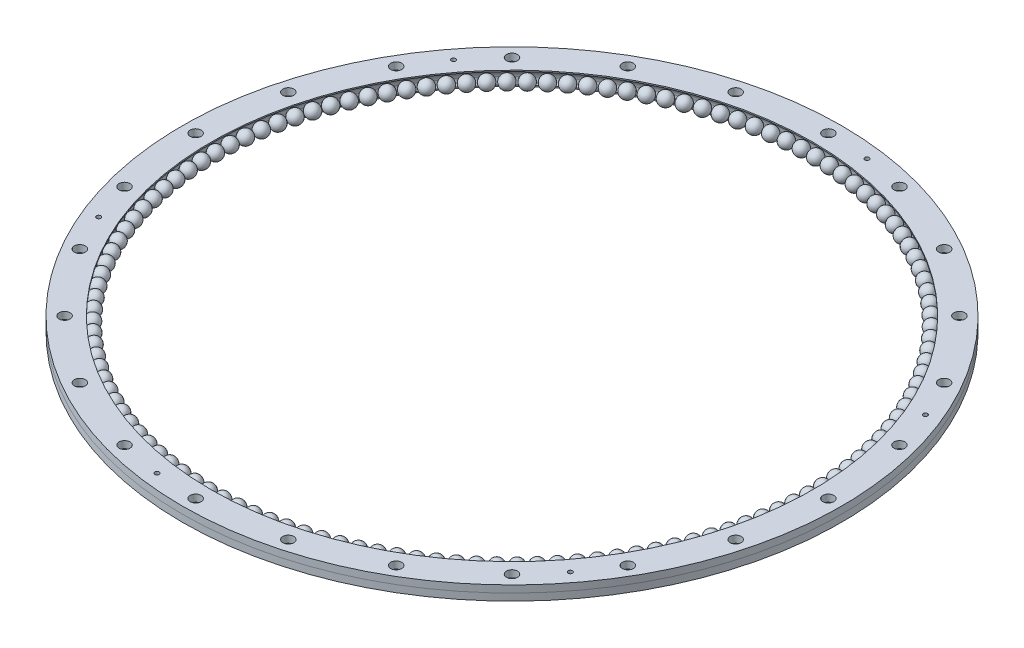
from build123d import *

# Parameters (mm, degrees)
BEARINGBALLPATTERN_COUNT           = 130
SKETCH3_R                          = 1.6
MOUNTINGTHRUHOLE_DEPTH             = 107.114278021
SKETCH5_W                          = 1.25
SKETCH5_H                          = 1.6
MOUNTINGSCREWPATTERN_START         = 6.935
MOUNTINGSCREWPATTERN_OUTLINE_R     = 1.25
MOUNTINGSCREWPATTERN_DEPTH         = 3.2
MOUNTINGSCREWPATTERN_2_OUTLINE_R   = 1.6
MOUNTINGSCREWPATTERN_2_OUTLINE_R_2 = 1.25
MOUNTINGSCREWPATTERN_2_DEPTH       = 1.6
SKETCH6_R                          = 0.5
DOWELPINHOLE_DEPTH                 = 107.114278021
CIRPATTERN4_COUNT                  = 6


# Read off the part's stored shape, not the designer's step: MountingScrewPattern
with BuildPart() as part:
    # Sketch1 → Revolve1 (revolve)
    with BuildSketch(Plane.XY, mode=Mode.PRIVATE) as revolve1_sk:
        with BuildLine():
            Line((-68.5, 6.935), (-68.5, 7.212124344))
            ThreePointArc((-68.5, 7.212124344), (-69, 8.535), (-68.5, 9.857875656))
            Line((-68.5, 9.857875656), (-68.5, 10.135))
            Line((-68.5, 10.135), (-75, 10.135))
            Line((-75, 10.135), (-75, 6.935))
            Line((-75, 6.935), (-68.5, 6.935))
        make_face()
    revolve(revolve1_sk.sketch.rotate(Axis((0, -200069.047495165, 0), (0, 1, 0)), 270), axis=Axis((0, -200069.047495165, 0), (0, 1, 0)))


with BuildPart() as body_2:
    # Split1: the piece on the far side of the plane
    add(part.part)
    split(bisect_by=Plane.ZX.offset(8.535), keep=Keep.BOTTOM)

    # Sketch3 → MountingThruHole (cut, through all)
    with BuildSketch(Plane.XZ.offset(-6.935)):
        with Locations(Location((0, -72, 0), (0, 0, 270))):
            Circle(SKETCH3_R)
    extrude(amount=-MOUNTINGTHRUHOLE_DEPTH, mode=Mode.SUBTRACT)


with BuildPart() as part_1:
    add(part.part)

    # Split1
    split(bisect_by=Plane.ZX.offset(8.535), keep=Keep.TOP)

    # Sketch5 → M3x0.5 Tapped Hole1 (revolve, cut)
    with BuildSketch(Plane(origin=(0, 8.535, -72), x_dir=(0, 0, -1), z_dir=(1, 0, 0))):
        with Locations((0.625, 0.8)):
            Rectangle(SKETCH5_W, SKETCH5_H)
    revolve(axis=Axis((0, 2.185, -72), (0, 1, 0)), mode=Mode.SUBTRACT)


with BuildPart() as body_3:
    # Sketch2 → BearingBall (revolve)
    with BuildSketch(Plane.XY):
        with BuildLine():
            Line((-67.5, 7.035), (-67.5, 10.035))
            ThreePointArc((-67.5, 10.035), (-69, 8.535), (-67.5, 7.035))
        make_face()
    revolve(axis=Axis((-67.5, 10.035, 0), (0, 1, 0)))

    # BearingBallPattern: body 3 ×130 about axis
    bearingballpattern_axis = Axis((0, 0, 0), (0, 1, 0))


with BuildPart() as body_3_1:
    add(body_3.part)
    for i in range(1, BEARINGBALLPATTERN_COUNT):
        add(body_3.part.rotate(bearingballpattern_axis, i * 360 / BEARINGBALLPATTERN_COUNT))


with BuildPart() as mountingscrewpattern_tool:
    # MountingScrewPattern outline → MountingScrewPattern (new body)
    with BuildSketch(Plane(origin=(0, 0, 0), x_dir=(1, 0, 0), z_dir=(0, 1, 0)).offset(MOUNTINGSCREWPATTERN_START)):
        with Locations((18.634971247, 69.546659493)):
            Circle(MOUNTINGSCREWPATTERN_OUTLINE_R)
        with Locations((-18.634971247, 69.546659493)):
            Circle(MOUNTINGSCREWPATTERN_OUTLINE_R)
        with Locations((-36, 62.353829072)):
            Circle(MOUNTINGSCREWPATTERN_OUTLINE_R)
        with Locations((-50.911688245, 50.911688245)):
            Circle(MOUNTINGSCREWPATTERN_OUTLINE_R)
        with Locations((-62.353829072, 36)):
            Circle(MOUNTINGSCREWPATTERN_OUTLINE_R)
        with Locations((-69.546659493, 18.634971247)):
            Circle(MOUNTINGSCREWPATTERN_OUTLINE_R)
        with Locations((-72, 0)):
            Circle(MOUNTINGSCREWPATTERN_OUTLINE_R)
        with Locations((36, 62.353829072)):
            Circle(MOUNTINGSCREWPATTERN_OUTLINE_R)
        with Locations((50.911688245, 50.911688245)):
            Circle(MOUNTINGSCREWPATTERN_OUTLINE_R)
        with Locations((62.353829072, 36)):
            Circle(MOUNTINGSCREWPATTERN_OUTLINE_R)
        with Locations((69.546659493, 18.634971247)):
            Circle(MOUNTINGSCREWPATTERN_OUTLINE_R)
        with Locations((72, 0)):
            Circle(MOUNTINGSCREWPATTERN_OUTLINE_R)
        with Locations((69.546659493, -18.634971247)):
            Circle(MOUNTINGSCREWPATTERN_OUTLINE_R)
        with Locations((62.353829072, -36)):
            Circle(MOUNTINGSCREWPATTERN_OUTLINE_R)
        with Locations((50.911688245, -50.911688245)):
            Circle(MOUNTINGSCREWPATTERN_OUTLINE_R)
        with Locations((36, -62.353829072)):
            Circle(MOUNTINGSCREWPATTERN_OUTLINE_R)
        with Locations((18.634971247, -69.546659493)):
            Circle(MOUNTINGSCREWPATTERN_OUTLINE_R)
        with Locations((0, -72)):
            Circle(MOUNTINGSCREWPATTERN_OUTLINE_R)
        with Locations((-18.634971247, -69.546659493)):
            Circle(MOUNTINGSCREWPATTERN_OUTLINE_R)
        with Locations((-36, -62.353829072)):
            Circle(MOUNTINGSCREWPATTERN_OUTLINE_R)
        with Locations((-50.911688245, -50.911688245)):
            Circle(MOUNTINGSCREWPATTERN_OUTLINE_R)
        with Locations((-62.353829072, -36)):
            Circle(MOUNTINGSCREWPATTERN_OUTLINE_R)
        with Locations((-69.546659493, -18.634971247)):
            Circle(MOUNTINGSCREWPATTERN_OUTLINE_R)
    extrude(amount=MOUNTINGSCREWPATTERN_DEPTH)


with BuildPart() as part_2:
    add(part_1.part)

    # MountingScrewPattern: cut by mountingscrewpattern_tool
    add(mountingscrewpattern_tool.part, mode=Mode.SUBTRACT)


with BuildPart() as body_2_1:
    add(body_2.part)

    # MountingScrewPattern: cut by mountingscrewpattern_tool
    add(mountingscrewpattern_tool.part, mode=Mode.SUBTRACT)

    # MountingScrewPattern 2 outline → MountingScrewPattern 2 (cut)
    # profile 1 of 23: a face of its own
    with BuildSketch(Plane(origin=(0, 0, 0), x_dir=(1, 0, 0), z_dir=(0, 1, 0)).offset(MOUNTINGSCREWPATTERN_START)):
        with Locations((18.634971247, 69.546659493)):
            Circle(MOUNTINGSCREWPATTERN_2_OUTLINE_R)
        with Locations((18.634971247, 69.546659493)):
            Circle(MOUNTINGSCREWPATTERN_2_OUTLINE_R_2, mode=Mode.SUBTRACT)
    # profile 2 of 23: a face of its own
    with BuildSketch(Plane(origin=(0, 0, 0), x_dir=(1, 0, 0), z_dir=(0, 1, 0)).offset(MOUNTINGSCREWPATTERN_START)):
        with Locations((-18.634971247, 69.546659493)):
            Circle(MOUNTINGSCREWPATTERN_2_OUTLINE_R)
        with Locations((-18.634971247, 69.546659493)):
            Circle(MOUNTINGSCREWPATTERN_2_OUTLINE_R_2, mode=Mode.SUBTRACT)
    # profile 3 of 23: a face of its own
    with BuildSketch(Plane(origin=(0, 0, 0), x_dir=(1, 0, 0), z_dir=(0, 1, 0)).offset(MOUNTINGSCREWPATTERN_START)):
        with Locations((-36, 62.353829072)):
            Circle(MOUNTINGSCREWPATTERN_2_OUTLINE_R)
        with Locations((-36, 62.353829072)):
            Circle(MOUNTINGSCREWPATTERN_2_OUTLINE_R_2, mode=Mode.SUBTRACT)
    # profile 4 of 23: a face of its own
    with BuildSketch(Plane(origin=(0, 0, 0), x_dir=(1, 0, 0), z_dir=(0, 1, 0)).offset(MOUNTINGSCREWPATTERN_START)):
        with Locations((-50.911688245, 50.911688245)):
            Circle(MOUNTINGSCREWPATTERN_2_OUTLINE_R)
        with Locations((-50.911688245, 50.911688245)):
            Circle(MOUNTINGSCREWPATTERN_2_OUTLINE_R_2, mode=Mode.SUBTRACT)
    # profile 5 of 23: a face of its own
    with BuildSketch(Plane(origin=(0, 0, 0), x_dir=(1, 0, 0), z_dir=(0, 1, 0)).offset(MOUNTINGSCREWPATTERN_START)):
        with Locations((-62.353829072, 36)):
            Circle(MOUNTINGSCREWPATTERN_2_OUTLINE_R)
        with Locations((-62.353829072, 36)):
            Circle(MOUNTINGSCREWPATTERN_2_OUTLINE_R_2, mode=Mode.SUBTRACT)
    # profile 6 of 23: a face of its own
    with BuildSketch(Plane(origin=(0, 0, 0), x_dir=(1, 0, 0), z_dir=(0, 1, 0)).offset(MOUNTINGSCREWPATTERN_START)):
        with Locations((-69.546659493, 18.634971247)):
            Circle(MOUNTINGSCREWPATTERN_2_OUTLINE_R)
        with Locations((-69.546659493, 18.634971247)):
            Circle(MOUNTINGSCREWPATTERN_2_OUTLINE_R_2, mode=Mode.SUBTRACT)
    # profile 7 of 23: a face of its own
    with BuildSketch(Plane(origin=(0, 0, 0), x_dir=(1, 0, 0), z_dir=(0, 1, 0)).offset(MOUNTINGSCREWPATTERN_START)):
        with Locations((-72, 0)):
            Circle(MOUNTINGSCREWPATTERN_2_OUTLINE_R)
        with Locations((-72, 0)):
            Circle(MOUNTINGSCREWPATTERN_2_OUTLINE_R_2, mode=Mode.SUBTRACT)
    # profile 8 of 23: a face of its own
    with BuildSketch(Plane(origin=(0, 0, 0), x_dir=(1, 0, 0), z_dir=(0, 1, 0)).offset(MOUNTINGSCREWPATTERN_START)):
        with Locations((36, 62.353829072)):
            Circle(MOUNTINGSCREWPATTERN_2_OUTLINE_R)
        with Locations((36, 62.353829072)):
            Circle(MOUNTINGSCREWPATTERN_2_OUTLINE_R_2, mode=Mode.SUBTRACT)
    # profile 9 of 23: a face of its own
    with BuildSketch(Plane(origin=(0, 0, 0), x_dir=(1, 0, 0), z_dir=(0, 1, 0)).offset(MOUNTINGSCREWPATTERN_START)):
        with Locations((50.911688245, 50.911688245)):
            Circle(MOUNTINGSCREWPATTERN_2_OUTLINE_R)
        with Locations((50.911688245, 50.911688245)):
            Circle(MOUNTINGSCREWPATTERN_2_OUTLINE_R_2, mode=Mode.SUBTRACT)
    # profile 10 of 23: a face of its own
    with BuildSketch(Plane(origin=(0, 0, 0), x_dir=(1, 0, 0), z_dir=(0, 1, 0)).offset(MOUNTINGSCREWPATTERN_START)):
        with Locations((62.353829072, 36)):
            Circle(MOUNTINGSCREWPATTERN_2_OUTLINE_R)
        with Locations((62.353829072, 36)):
            Circle(MOUNTINGSCREWPATTERN_2_OUTLINE_R_2, mode=Mode.SUBTRACT)
    # profile 11 of 23: a face of its own
    with BuildSketch(Plane(origin=(0, 0, 0), x_dir=(1, 0, 0), z_dir=(0, 1, 0)).offset(MOUNTINGSCREWPATTERN_START)):
        with Locations((69.546659493, 18.634971247)):
            Circle(MOUNTINGSCREWPATTERN_2_OUTLINE_R)
        with Locations((69.546659493, 18.634971247)):
            Circle(MOUNTINGSCREWPATTERN_2_OUTLINE_R_2, mode=Mode.SUBTRACT)
    # profile 12 of 23: a face of its own
    with BuildSketch(Plane(origin=(0, 0, 0), x_dir=(1, 0, 0), z_dir=(0, 1, 0)).offset(MOUNTINGSCREWPATTERN_START)):
        with Locations((72, 0)):
            Circle(MOUNTINGSCREWPATTERN_2_OUTLINE_R)
        with Locations((72, 0)):
            Circle(MOUNTINGSCREWPATTERN_2_OUTLINE_R_2, mode=Mode.SUBTRACT)
    # profile 13 of 23: a face of its own
    with BuildSketch(Plane(origin=(0, 0, 0), x_dir=(1, 0, 0), z_dir=(0, 1, 0)).offset(MOUNTINGSCREWPATTERN_START)):
        with Locations((69.546659493, -18.634971247)):
            Circle(MOUNTINGSCREWPATTERN_2_OUTLINE_R)
        with Locations((69.546659493, -18.634971247)):
            Circle(MOUNTINGSCREWPATTERN_2_OUTLINE_R_2, mode=Mode.SUBTRACT)
    # profile 14 of 23: a face of its own
    with BuildSketch(Plane(origin=(0, 0, 0), x_dir=(1, 0, 0), z_dir=(0, 1, 0)).offset(MOUNTINGSCREWPATTERN_START)):
        with Locations((62.353829072, -36)):
            Circle(MOUNTINGSCREWPATTERN_2_OUTLINE_R)
        with Locations((62.353829072, -36)):
            Circle(MOUNTINGSCREWPATTERN_2_OUTLINE_R_2, mode=Mode.SUBTRACT)
    # profile 15 of 23: a face of its own
    with BuildSketch(Plane(origin=(0, 0, 0), x_dir=(1, 0, 0), z_dir=(0, 1, 0)).offset(MOUNTINGSCREWPATTERN_START)):
        with Locations((50.911688245, -50.911688245)):
            Circle(MOUNTINGSCREWPATTERN_2_OUTLINE_R)
        with Locations((50.911688245, -50.911688245)):
            Circle(MOUNTINGSCREWPATTERN_2_OUTLINE_R_2, mode=Mode.SUBTRACT)
    # profile 16 of 23: a face of its own
    with BuildSketch(Plane(origin=(0, 0, 0), x_dir=(1, 0, 0), z_dir=(0, 1, 0)).offset(MOUNTINGSCREWPATTERN_START)):
        with Locations((36, -62.353829072)):
            Circle(MOUNTINGSCREWPATTERN_2_OUTLINE_R)
        with Locations((36, -62.353829072)):
            Circle(MOUNTINGSCREWPATTERN_2_OUTLINE_R_2, mode=Mode.SUBTRACT)
    # profile 17 of 23: a face of its own
    with BuildSketch(Plane(origin=(0, 0, 0), x_dir=(1, 0, 0), z_dir=(0, 1, 0)).offset(MOUNTINGSCREWPATTERN_START)):
        with Locations((18.634971247, -69.546659493)):
            Circle(MOUNTINGSCREWPATTERN_2_OUTLINE_R)
        with Locations((18.634971247, -69.546659493)):
            Circle(MOUNTINGSCREWPATTERN_2_OUTLINE_R_2, mode=Mode.SUBTRACT)
    # profile 18 of 23: a face of its own
    with BuildSketch(Plane(origin=(0, 0, 0), x_dir=(1, 0, 0), z_dir=(0, 1, 0)).offset(MOUNTINGSCREWPATTERN_START)):
        with Locations((0, -72)):
            Circle(MOUNTINGSCREWPATTERN_2_OUTLINE_R)
        with Locations((0, -72)):
            Circle(MOUNTINGSCREWPATTERN_2_OUTLINE_R_2, mode=Mode.SUBTRACT)
    # profile 19 of 23: a face of its own
    with BuildSketch(Plane(origin=(0, 0, 0), x_dir=(1, 0, 0), z_dir=(0, 1, 0)).offset(MOUNTINGSCREWPATTERN_START)):
        with Locations((-18.634971247, -69.546659493)):
            Circle(MOUNTINGSCREWPATTERN_2_OUTLINE_R)
        with Locations((-18.634971247, -69.546659493)):
            Circle(MOUNTINGSCREWPATTERN_2_OUTLINE_R_2, mode=Mode.SUBTRACT)
    # profile 20 of 23: a face of its own
    with BuildSketch(Plane(origin=(0, 0, 0), x_dir=(1, 0, 0), z_dir=(0, 1, 0)).offset(MOUNTINGSCREWPATTERN_START)):
        with Locations((-36, -62.353829072)):
            Circle(MOUNTINGSCREWPATTERN_2_OUTLINE_R)
        with Locations((-36, -62.353829072)):
            Circle(MOUNTINGSCREWPATTERN_2_OUTLINE_R_2, mode=Mode.SUBTRACT)
    # profile 21 of 23: a face of its own
    with BuildSketch(Plane(origin=(0, 0, 0), x_dir=(1, 0, 0), z_dir=(0, 1, 0)).offset(MOUNTINGSCREWPATTERN_START)):
        with Locations((-50.911688245, -50.911688245)):
            Circle(MOUNTINGSCREWPATTERN_2_OUTLINE_R)
        with Locations((-50.911688245, -50.911688245)):
            Circle(MOUNTINGSCREWPATTERN_2_OUTLINE_R_2, mode=Mode.SUBTRACT)
    # profile 22 of 23: a face of its own
    with BuildSketch(Plane(origin=(0, 0, 0), x_dir=(1, 0, 0), z_dir=(0, 1, 0)).offset(MOUNTINGSCREWPATTERN_START)):
        with Locations((-62.353829072, -36)):
            Circle(MOUNTINGSCREWPATTERN_2_OUTLINE_R)
        with Locations((-62.353829072, -36)):
            Circle(MOUNTINGSCREWPATTERN_2_OUTLINE_R_2, mode=Mode.SUBTRACT)
    # profile 23 of 23: a face of its own
    with BuildSketch(Plane(origin=(0, 0, 0), x_dir=(1, 0, 0), z_dir=(0, 1, 0)).offset(MOUNTINGSCREWPATTERN_START)):
        with Locations((-69.546659493, -18.634971247)):
            Circle(MOUNTINGSCREWPATTERN_2_OUTLINE_R)
        with Locations((-69.546659493, -18.634971247)):
            Circle(MOUNTINGSCREWPATTERN_2_OUTLINE_R_2, mode=Mode.SUBTRACT)
    extrude(amount=MOUNTINGSCREWPATTERN_2_DEPTH, mode=Mode.SUBTRACT)


with BuildPart() as dowelpinhole_tool:
    # Sketch6 → DowelPinHole (new, through all)
    with BuildSketch(Plane(origin=(0, 10.135, 0), x_dir=(1, 0, 0), z_dir=(0, 1, 0))):
        with Locations(Location((9.39788584, 71.384030019, 0), (0, 0, 270))):
            Circle(SKETCH6_R)
    dowelpinhole = extrude(amount=-DOWELPINHOLE_DEPTH)


with BuildPart() as part_3:
    add(part_2.part)

    # DowelPinHole: cut by dowelpinhole_tool
    add(dowelpinhole_tool.part, mode=Mode.SUBTRACT)


with BuildPart() as body_2_2:
    add(body_2_1.part)

    # DowelPinHole: cut by dowelpinhole_tool
    add(dowelpinhole_tool.part, mode=Mode.SUBTRACT)


with BuildPart() as cirpattern4_tool:
    # CirPattern4: DowelPinHole ×6 about axis
    cirpattern4_axis = Axis((0, 0, 0), (0, 1, 0))
    for i in range(1, CIRPATTERN4_COUNT):
        add(dowelpinhole.rotate(cirpattern4_axis, i * 360 / CIRPATTERN4_COUNT))


with BuildPart() as part_4:
    add(part_3.part)

    # CirPattern4: cut by cirpattern4_tool
    add(cirpattern4_tool.part, mode=Mode.SUBTRACT)


with BuildPart() as body_2_3:
    add(body_2_2.part)

    # CirPattern4: cut by cirpattern4_tool
    add(cirpattern4_tool.part, mode=Mode.SUBTRACT)


solid = Compound([body_3_1.part, part_4.part, body_2_3.part])
